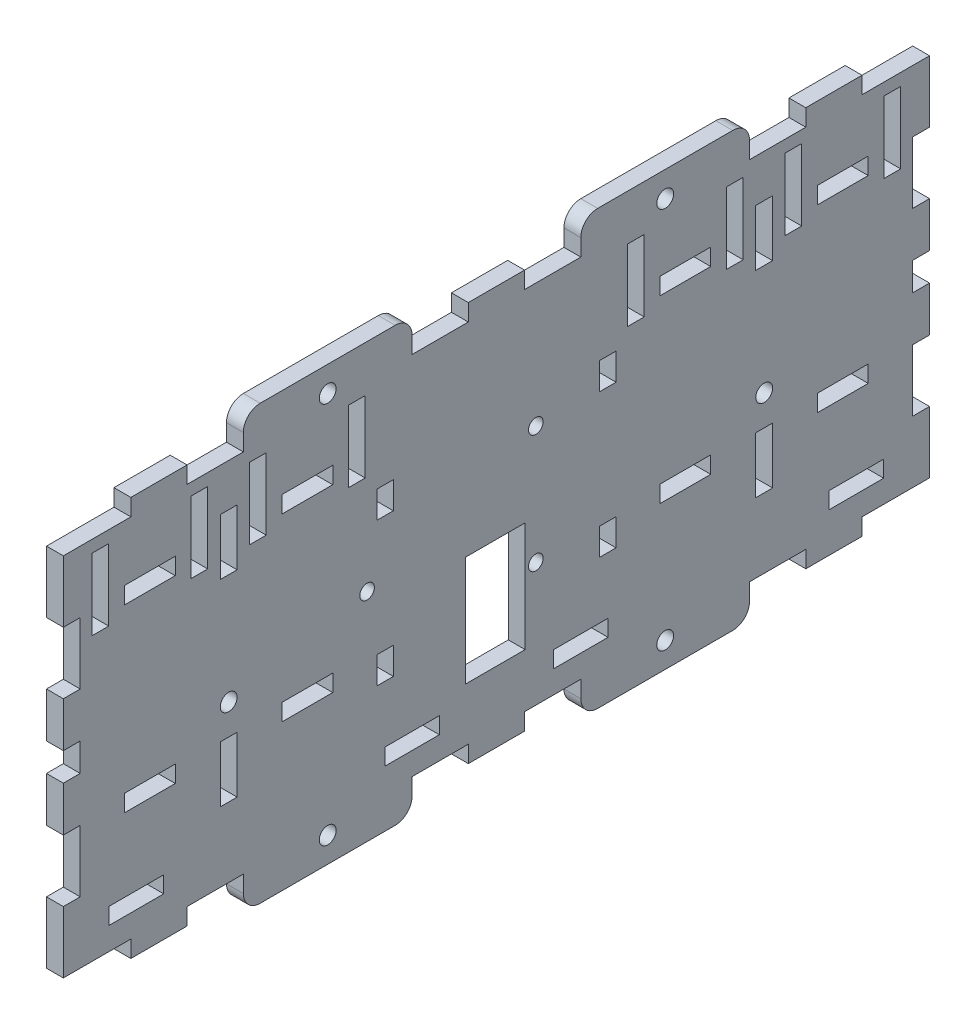
from build123d import *

# Parameters (mm, degrees)
CROQUIS1_W               = 154
CROQUIS1_H               = 71
SALIENTE_EXTRUIR1_DEPTH  = 1.5
CROQUIS2_W               = 12
CROQUIS2_H               = 3
CROQUIS2_W_2             = 10
CROQUIS2_W_3             = 3
CROQUIS2_H_2             = 11
CROQUIS2_H_3             = 5
CORTAR_EXTRUIR1_DEPTH    = 13
CROQUIS4_W               = 30
CROQUIS4_H               = 3
SALIENTE_EXTRUIR3_DEPTH  = 3
REDONDEO2_R              = 3
CROQUIS5_R               = 1.5
CORTAR_EXTRUIR2_DEPTH    = 3
REDONDEO2_OF_SIMETR_A4_R = 3
SIMETR_A5_START          = -1.5
SIMETR_A5_OUTLINE_R      = 1.5
SIMETR_A5_DEPTH          = 3
SIMETR_A5_2_DEPTH        = 3
CROQUIS6_W               = 3
CROQUIS6_H               = 10
CROQUIS6_W_2             = 9.7
CROQUIS6_H_2             = 2.94
CROQUIS6_W_3             = 2.94
CROQUIS6_H_3             = 12.7
CROQUIS6_W_4             = 10.628979849
CROQUIS6_H_4             = 19.526562675
CORTAR_EXTRUIR3_DEPTH    = 10
CROQUIS7_R               = 1.5
CORTAR_EXTRUIR4_DEPTH    = 10
CROQUIS8_W               = 9
CROQUIS8_H               = 3
CORTAR_EXTRUIR5_DEPTH    = 10
CROQUIS9_R               = 1.3
CORTAR_EXTRUIR6_DEPTH    = 10
CROQUIS10_W              = 2.94
CROQUIS10_H              = 4.8
CORTAR_EXTRUIR7_DEPTH    = 23


# Read off the part's stored shape, not the designer's step: Simetría5
with BuildPart() as part:
    # Croquis1 → Saliente-Extruir1 (new, symmetric)
    with BuildSketch(Plane(origin=(0, 0, 0), x_dir=(0, 0, -1), z_dir=(1, 0, 0))):
        Rectangle(CROQUIS1_W, CROQUIS1_H)
    extrude(amount=SALIENTE_EXTRUIR1_DEPTH, both=True)

    # Croquis2 → Cortar-Extruir1 (cut)
    with BuildSketch(Plane(origin=(1.5, 0, 0), x_dir=(0, 0, -1), z_dir=(1, 0, 0))):
        with Locations((-71, 34)):
            Rectangle(CROQUIS2_W, CROQUIS2_H)
        with Locations((-50, 34)):
            Rectangle(CROQUIS2_W_2, CROQUIS2_H)
        with Locations((-10, 34)):
            Rectangle(CROQUIS2_W_2, CROQUIS2_H)
        with Locations((10, 34)):
            Rectangle(CROQUIS2_W_2, CROQUIS2_H)
        with Locations((50, 34)):
            Rectangle(CROQUIS2_W_2, CROQUIS2_H)
        with Locations((71, 34)):
            Rectangle(CROQUIS2_W, CROQUIS2_H)
        with Locations((50, -34)):
            Rectangle(CROQUIS2_W_2, CROQUIS2_H)
        with Locations((10, -34)):
            Rectangle(CROQUIS2_W_2, CROQUIS2_H)
        with Locations((-10, -34)):
            Rectangle(CROQUIS2_W_2, CROQUIS2_H)
        with Locations((-50, -34)):
            Rectangle(CROQUIS2_W_2, CROQUIS2_H)
        with Locations((-71, -34)):
            Rectangle(CROQUIS2_W, CROQUIS2_H)
        with Locations((71, -34)):
            Rectangle(CROQUIS2_W, CROQUIS2_H)
        with Locations((-75.5, -16)):
            Rectangle(CROQUIS2_W_3, CROQUIS2_H_2)
        with Locations((-75.5, 0)):
            Rectangle(CROQUIS2_W_3, CROQUIS2_H_3)
        with Locations((-75.5, 16)):
            Rectangle(CROQUIS2_W_3, CROQUIS2_H_2)
        with Locations((75.5, -16)):
            Rectangle(CROQUIS2_W_3, CROQUIS2_H_2)
        with Locations((75.5, 16)):
            Rectangle(CROQUIS2_W_3, CROQUIS2_H_2)
        with Locations((75.5, 0)):
            Rectangle(CROQUIS2_W_3, CROQUIS2_H_3)
    extrude(amount=-CORTAR_EXTRUIR1_DEPTH, mode=Mode.SUBTRACT)

    # Croquis4 → Saliente-Extruir3 (add)
    with BuildSketch(Plane(origin=(1.5, 0, 0), x_dir=(0, 0, -1), z_dir=(1, 0, 0))):
        with Locations((-30, 37)):
            Rectangle(CROQUIS4_W, CROQUIS4_H)
    saliente_extruir3 = extrude(amount=-SALIENTE_EXTRUIR3_DEPTH)

    # Redondeo2
    redondeo2_edges = [part.edges().sort_by_distance(p)[0] for p in [
        (0, 38.5, 45),
        (0, 38.5, 15),
    ]]
    fillet(redondeo2_edges, radius=REDONDEO2_R)

    # Croquis5 → Cortar-Extruir2 (cut)
    with BuildSketch(Plane(origin=(1.5, 0, 0), x_dir=(0, 0, -1), z_dir=(1, 0, 0))):
        with Locations((-30, 34)):
            Circle(CROQUIS5_R)
    cortar_extruir2 = extrude(amount=-CORTAR_EXTRUIR2_DEPTH, mode=Mode.SUBTRACT)

    # Simetría4: Saliente-Extruir3, Cortar-Extruir2 across plane
    add(saliente_extruir3.mirror(Plane.ZX))
    add(cortar_extruir2.mirror(Plane.ZX), mode=Mode.SUBTRACT)

    # Redondeo2 of Simetría4
    redondeo2_of_simetr_a4_edges = [part.edges().sort_by_distance(p)[0] for p in [
        (0, -38.5, 45),
        (0, -38.5, 15),
    ]]
    fillet(redondeo2_of_simetr_a4_edges, radius=REDONDEO2_OF_SIMETR_A4_R)

    # Simetría5 outline → Simetría5 (cut)
    with BuildSketch(Plane.YZ.offset(SIMETR_A5_START)):
        with Locations((34, -30)):
            Circle(SIMETR_A5_OUTLINE_R)
        with Locations((-34, -30)):
            Circle(SIMETR_A5_OUTLINE_R)
    extrude(amount=SIMETR_A5_DEPTH, mode=Mode.SUBTRACT)

    # Simetr_a5 2 outline → Simetr_a5 2 (add)
    with BuildSketch(Plane.YZ.offset(SIMETR_A5_START)):
        with BuildLine():
            Line((38.5, -42), (38.5, -18))
            ThreePointArc((38.5, -18), (37.621320344, -15.878679656), (35.5, -15))
            Line((35.5, -15), (35.5, -45))
            ThreePointArc((35.5, -45), (37.621320344, -44.121320344), (38.5, -42))
        make_face()
        with BuildLine():
            ThreePointArc((-35.5, -15), (-37.621320344, -15.878679656), (-38.5, -18))
            Line((-38.5, -18), (-38.5, -42))
            ThreePointArc((-38.5, -42), (-37.621320344, -44.121320344), (-35.5, -45))
            Line((-35.5, -45), (-35.5, -15))
        make_face()
    extrude(amount=SIMETR_A5_2_DEPTH)

    # Croquis6 → Cortar-Extruir3 (cut)
    with BuildSketch(Plane.ZY.offset(1.5)):
        with Locations((47.6, -15.1)):
            Rectangle(CROQUIS6_W, CROQUIS6_H)
        with Locations((47.6, 19.9)):
            Rectangle(CROQUIS6_W, CROQUIS6_H)
        with Locations((-47.6, -15.1)):
            Rectangle(CROQUIS6_W, CROQUIS6_H)
        with Locations((-47.6, 19.9)):
            Rectangle(CROQUIS6_W, CROQUIS6_H)
        with Locations((15, -27)):
            Rectangle(CROQUIS6_W_2, CROQUIS6_H_2)
        with Locations((64, -27)):
            Rectangle(CROQUIS6_W_2, CROQUIS6_H_2)
        with Locations((24.8, 24)):
            Rectangle(CROQUIS6_W_3, CROQUIS6_H_3)
        with Locations((42.4, 24)):
            Rectangle(CROQUIS6_W_3, CROQUIS6_H_3)
        with Locations((52.8, 24)):
            Rectangle(CROQUIS6_W_3, CROQUIS6_H_3)
        with Locations((70.4, 24)):
            Rectangle(CROQUIS6_W_3, CROQUIS6_H_3)
        with Locations((-70.4, 24)):
            Rectangle(CROQUIS6_W_3, CROQUIS6_H_3)
        with Locations((-52.8, 24)):
            Rectangle(CROQUIS6_W_3, CROQUIS6_H_3)
        with Locations((-42.4, 24)):
            Rectangle(CROQUIS6_W_3, CROQUIS6_H_3)
        with Locations((-24.8, 24)):
            Rectangle(CROQUIS6_W_3, CROQUIS6_H_3)
        with Locations((-64, -27)):
            Rectangle(CROQUIS6_W_2, CROQUIS6_H_2)
        with Locations((-15, -27)):
            Rectangle(CROQUIS6_W_2, CROQUIS6_H_2)
        with Locations((0.209178282, -13.227366202)):
            Rectangle(CROQUIS6_W_4, CROQUIS6_H_4)
    extrude(amount=-CORTAR_EXTRUIR3_DEPTH, mode=Mode.SUBTRACT)

    # Croquis7 → Cortar-Extruir4 (cut)
    with BuildSketch(Plane(origin=(1.5, 0, 0), x_dir=(0, 0, -1), z_dir=(1, 0, 0))):
        with Locations((-47.6, -4.7)):
            Circle(CROQUIS7_R)
        with Locations(Location((47.6, -4.7, 0), (0, 0, 180))):
            Circle(CROQUIS7_R)
    extrude(amount=-CORTAR_EXTRUIR4_DEPTH, mode=Mode.SUBTRACT)

    # Croquis8 → Cortar-Extruir5 (cut)
    with BuildSketch(Plane.ZY.offset(1.5)):
        with Locations((61.6, 21)):
            Rectangle(CROQUIS8_W, CROQUIS8_H)
        with Locations((33.6, 21)):
            Rectangle(CROQUIS8_W, CROQUIS8_H)
        with Locations((-61.6, 21)):
            Rectangle(CROQUIS8_W, CROQUIS8_H)
        with Locations((-33.6, 21)):
            Rectangle(CROQUIS8_W, CROQUIS8_H)
        with Locations((-33.6, -11)):
            Rectangle(CROQUIS8_W, CROQUIS8_H)
        with Locations((-61.6, -11)):
            Rectangle(CROQUIS8_W, CROQUIS8_H)
        with Locations((33.6, -11)):
            Rectangle(CROQUIS8_W, CROQUIS8_H)
        with Locations((61.6, -11)):
            Rectangle(CROQUIS8_W, CROQUIS8_H)
    extrude(amount=-CORTAR_EXTRUIR5_DEPTH, mode=Mode.SUBTRACT)

    # Croquis9 → Cortar-Extruir6 (cut)
    with BuildSketch(Plane(origin=(1.5, 0, 0), x_dir=(0, 0, -1), z_dir=(1, 0, 0))):
        with Locations((-23, 0)):
            Circle(CROQUIS9_R)
        with Locations((7, 10.5)):
            Circle(CROQUIS9_R)
        with Locations((7, -10.5)):
            Circle(CROQUIS9_R)
    extrude(amount=-CORTAR_EXTRUIR6_DEPTH, mode=Mode.SUBTRACT)

    # Croquis10 → Cortar-Extruir7 (cut)
    with BuildSketch(Plane.ZY.offset(1.5)):
        with Locations((-19.8, 12.5)):
            Rectangle(CROQUIS10_W, CROQUIS10_H)
        with Locations((-19.8, -13)):
            Rectangle(CROQUIS10_W, CROQUIS10_H)
        with Locations((19.8, 12.5)):
            Rectangle(CROQUIS10_W, CROQUIS10_H)
        with Locations((19.8, -13)):
            Rectangle(CROQUIS10_W, CROQUIS10_H)
    extrude(amount=-CORTAR_EXTRUIR7_DEPTH, mode=Mode.SUBTRACT)


solid = part.part
